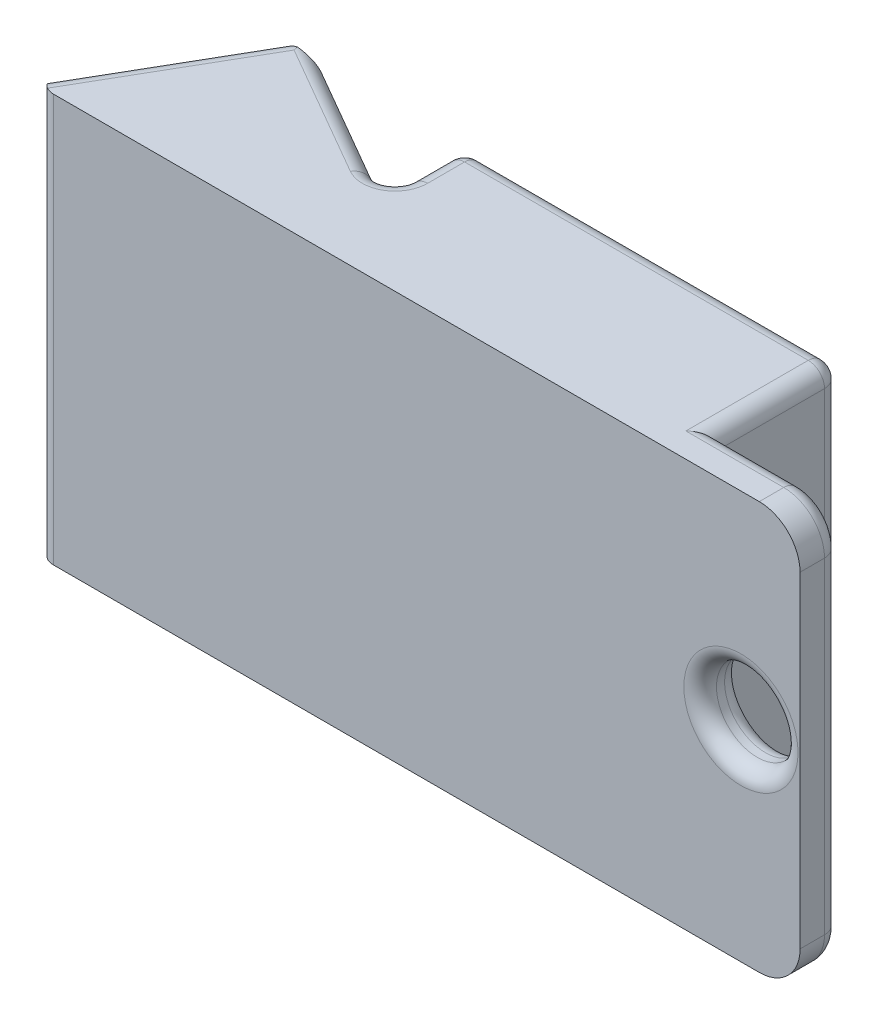
from build123d import *

# Parameters (mm, degrees)
SKETCH2_W           = 80
SKETCH2_H           = 20
BOSS_EXTRUDE1_DEPTH = 50
CUT_EXTRUDE1_DEPTH  = 50
SKETCH5_R           = 5
BOSS_EXTRUDE2_DEPTH = 5
FILLET1_R           = 2


with BuildPart() as part:
    # Sketch2 → Boss-Extrude1 (new body)
    with BuildSketch(Plane(origin=(0, 0, 0), x_dir=(1, 0, 0), z_dir=(0, 1, 0))):
        with Locations((7.295597484, 7.693920335)):
            Rectangle(SKETCH2_W, SKETCH2_H)
    extrude(amount=BOSS_EXTRUDE1_DEPTH)

    # Sketch3 → Cut-Extrude1 (cut)
    with BuildSketch(Plane(origin=(0, 50, 0), x_dir=(1, 0, 0), z_dir=(0, 1, 0))):
        Polygon((-32.704402516, 17.693920335), (-32.704402516, -2.306079665), (-21.157397132, 17.693920335), align=None)
        Polygon((1.163110944, 17.693920335), (-16.157397132, 17.693920335), (1.163110944, 7.693920335), align=None)
    extrude(amount=-CUT_EXTRUDE1_DEPTH, mode=Mode.SUBTRACT)

    # Sketch5 → Boss-Extrude2 (add)
    with BuildSketch(Plane.XY.offset(2.306079665)):
        with BuildLine():
            Line((47.295597484, 50), (57.295597484, 50))
            ThreePointArc((57.295597484, 50), (60.83113139, 48.535533906), (62.295597484, 45))
            Line((62.295597484, 45), (62.295597484, 5))
            ThreePointArc((62.295597484, 5), (60.83113139, 1.464466094), (57.295597484, 0))
            Line((57.295597484, 0), (47.295597484, 0))
            Line((47.295597484, 0), (47.295597484, 50))
        make_face()
        with Locations((55.048868237, 25.715581395)):
            Circle(SKETCH5_R, mode=Mode.SUBTRACT)
    extrude(amount=-BOSS_EXTRUDE2_DEPTH)

    # Fillet1
    # the kernel refuses this fillet: 2 mm, written as the material it adds along each edge
    with BuildSketch(Plane(origin=(1.163110944, 50, -7.693920335), x_dir=(0, 0, -1), z_dir=(0, -1, 0))) as fillet1_piece_1:
        with BuildLine():
            CenterArc((FILLET1_R * 1.73205080757, -FILLET1_R), FILLET1_R, 90, 120)
            Line((FILLET1_R * 0.866025403784, -FILLET1_R * 1.5), (0, 0))
            Line((0, 0), (FILLET1_R * 1.73205080757, 0))
        make_face()
    extrude(amount=50)
    # the kernel refuses this fillet: 2 mm, written as the material it takes off along each edge
    with BuildSketch(Plane(origin=(3.163110944, 2, -15.693920335), x_dir=(-1, 0, 0), z_dir=(0, -1, 0))) as fillet1_2_piece_1_section:
        Polygon((0, 0), (FILLET1_R, 0), (FILLET1_R, FILLET1_R), (0, FILLET1_R), align=None)
    fillet1_2_piece_1 = extrude(amount=FILLET1_R, mode=Mode.PRIVATE)
    fillet1_2_piece_1 = fillet1_2_piece_1 - Plane(origin=(3.163110944, 2, -15.693920335), x_dir=(0.7071067811865475, 0, 0.7071067811865475), z_dir=(0, -1, 0)) * Sphere(FILLET1_R, mode=Mode.PRIVATE)
    add(fillet1_2_piece_1, mode=Mode.SUBTRACT)
    with BuildSketch(Plane(origin=(3.163110944, 48, -15.693920335), x_dir=(-1, 0, 0), z_dir=(0, 1, 0))) as fillet1_2_piece_2_section:
        Polygon((0, 0), (FILLET1_R, 0), (FILLET1_R, -FILLET1_R), (0, -FILLET1_R), align=None)
    fillet1_2_piece_2 = extrude(amount=FILLET1_R, mode=Mode.PRIVATE)
    fillet1_2_piece_2 = fillet1_2_piece_2 - Plane(origin=(3.163110944, 48, -15.693920335), x_dir=(0.7071067811865475, 0, 0.7071067811865475), z_dir=(0, 1, 0)) * Sphere(FILLET1_R, mode=Mode.PRIVATE)
    add(fillet1_2_piece_2, mode=Mode.SUBTRACT)
    with BuildSketch(Plane(origin=(45.295597484, 2, -15.693920335), x_dir=(0, 0, -1), z_dir=(0, -1, 0))) as fillet1_2_piece_3_section:
        Polygon((0, 0), (FILLET1_R, 0), (FILLET1_R, FILLET1_R), (0, FILLET1_R), align=None)
    fillet1_2_piece_3 = extrude(amount=FILLET1_R, mode=Mode.PRIVATE)
    fillet1_2_piece_3 = fillet1_2_piece_3 - Plane(origin=(45.295597484, 2, -15.693920335), x_dir=(-0.7071067811865474, 0, 0.7071067811865477), z_dir=(0, -1, 0)) * Sphere(FILLET1_R, mode=Mode.PRIVATE)
    add(fillet1_2_piece_3, mode=Mode.SUBTRACT)
    with BuildSketch(Plane(origin=(45.295597484, 48, -15.693920335), x_dir=(0, 0, -1), z_dir=(0, 1, 0))) as fillet1_2_piece_4_section:
        Polygon((0, 0), (FILLET1_R, 0), (FILLET1_R, -FILLET1_R), (0, -FILLET1_R), align=None)
    fillet1_2_piece_4 = extrude(amount=FILLET1_R, mode=Mode.PRIVATE)
    fillet1_2_piece_4 = fillet1_2_piece_4 - Plane(origin=(45.295597484, 48, -15.693920335), x_dir=(-0.7071067811865474, 0, 0.7071067811865477), z_dir=(0, 1, 0)) * Sphere(FILLET1_R, mode=Mode.PRIVATE)
    add(fillet1_2_piece_4, mode=Mode.SUBTRACT)
    with BuildSketch(Plane(origin=(1.163110944, 0, -11.158021951), x_dir=(1, 0, 0), z_dir=(0, 0, -1))) as fillet1_2_piece_5:
        with BuildLine():
            CenterArc((FILLET1_R, -FILLET1_R), FILLET1_R, 90, 90)
            Line((0, -FILLET1_R), (0, 0))
            Line((0, 0), (FILLET1_R, 0))
        make_face()
    extrude(amount=4.535898385, mode=Mode.SUBTRACT)
    with BuildSketch(Plane(origin=(1.163110944, 50, -11.158021951), x_dir=(1, 0, 0), z_dir=(0, 0, -1))) as fillet1_2_piece_6:
        with BuildLine():
            CenterArc((FILLET1_R, FILLET1_R), FILLET1_R, 180, 90)
            Line((0, FILLET1_R), (0, 0))
            Line((0, 0), (FILLET1_R, 0))
        make_face()
    extrude(amount=4.535898385, mode=Mode.SUBTRACT)
    with BuildSketch(Plane(origin=(57.295597484, 0, -2.693920335), x_dir=(0, 0, 1), z_dir=(-1, 0, 0)), Plane(origin=(47.295597484, 50, -2.693920335), x_dir=(0, 0, 1), z_dir=(1, 0, 0))) as fillet1_2_piece_7:
        with BuildLine():
            CenterArc((FILLET1_R, FILLET1_R), FILLET1_R, 180, 90)
            Line((0, FILLET1_R), (0, 0))
            Line((0, 0), (FILLET1_R, 0))
        make_face()
    extrude(amount=10, mode=Mode.SUBTRACT)
    with BuildSketch(Plane(origin=(57.295597484, 5, -2.693920335), x_dir=(1, 0, 0), z_dir=(0, 1, 0))) as fillet1_2_piece_8:
        with BuildLine():
            CenterArc((5 - FILLET1_R, -FILLET1_R), FILLET1_R, 0, 90)
            Line((5, -FILLET1_R), (5, 0))
            Line((5, 0), (5 - FILLET1_R, 0))
        make_face()
    revolve(axis=Axis((57.295597484, 5, -2.693920335), (0, 0, -1)), revolution_arc=90, mode=Mode.SUBTRACT)
    with BuildSketch(Plane(origin=(62.295597484, 45, -2.693920335), x_dir=(-1, 0, 0), z_dir=(0, -1, 0))) as fillet1_2_piece_9:
        with BuildLine():
            CenterArc((FILLET1_R, -FILLET1_R), FILLET1_R, 90, 90)
            Line((0, -FILLET1_R), (0, 0))
            Line((0, 0), (FILLET1_R, 0))
        make_face()
    extrude(amount=40, mode=Mode.SUBTRACT)
    with BuildSketch(Plane(origin=(57.295597484, 45, -2.693920335), x_dir=(0, 1, 0), z_dir=(-1, 0, 0))) as fillet1_2_piece_10:
        with BuildLine():
            CenterArc((5 - FILLET1_R, -FILLET1_R), FILLET1_R, 0, 90)
            Line((5, -FILLET1_R), (5, 0))
            Line((5, 0), (5 - FILLET1_R, 0))
        make_face()
    revolve(axis=Axis((57.295597484, 45, -2.693920335), (0, 0, -1)), revolution_arc=90, mode=Mode.SUBTRACT)
    with BuildSketch(Plane(origin=(47.295597484, 2, -17.693920335), x_dir=(-1, 0, 0), z_dir=(0, 1, 0))) as fillet1_2_piece_11:
        with BuildLine():
            CenterArc((FILLET1_R, FILLET1_R), FILLET1_R, 180, 90)
            Line((0, FILLET1_R), (0, 0))
            Line((0, 0), (FILLET1_R, 0))
        make_face()
    extrude(amount=46, mode=Mode.SUBTRACT)
    with BuildSketch(Plane(origin=(3.163110944, 50, -17.693920335), x_dir=(0, 0, 1), z_dir=(1, 0, 0))) as fillet1_2_piece_12:
        with BuildLine():
            CenterArc((FILLET1_R, FILLET1_R), FILLET1_R, 180, 90)
            Line((0, FILLET1_R), (0, 0))
            Line((0, 0), (FILLET1_R, 0))
        make_face()
    extrude(amount=42.132486541, mode=Mode.SUBTRACT)
    with BuildSketch(Plane(origin=(1.163110944, 48, -17.693920335), x_dir=(0, 0, 1), z_dir=(0, -1, 0))) as fillet1_2_piece_13:
        with BuildLine():
            CenterArc((FILLET1_R, -FILLET1_R), FILLET1_R, 90, 90)
            Line((0, -FILLET1_R), (0, 0))
            Line((0, 0), (FILLET1_R, 0))
        make_face()
    extrude(amount=46, mode=Mode.SUBTRACT)
    with BuildSketch(Plane(origin=(3.163110944, 0, -17.693920335), x_dir=(0, 0, 1), z_dir=(1, 0, 0))) as fillet1_2_piece_14:
        with BuildLine():
            CenterArc((FILLET1_R, -FILLET1_R), FILLET1_R, 90, 90)
            Line((0, -FILLET1_R), (0, 0))
            Line((0, 0), (FILLET1_R, 0))
        make_face()
    extrude(amount=42.132486541, mode=Mode.SUBTRACT)
    with BuildSketch(Plane(origin=(55.048868237, 25.715581395, 2.306079665), x_dir=(1, 0, 0), z_dir=(0, -1, 0))) as fillet1_2_piece_15:
        with BuildLine():
            CenterArc((5 + FILLET1_R, -FILLET1_R), FILLET1_R, 90, 90)
            Line((5, -FILLET1_R), (5, 0))
            Line((5, 0), (5 + FILLET1_R, 0))
        make_face()
    revolve(axis=Axis((55.048868237, 25.715581395, 2.306079665), (0, 0, 1)), mode=Mode.SUBTRACT)
    with BuildSketch(Plane(origin=(55.048868237, 25.715581395, -2.693920335), x_dir=(1, 0, 0), z_dir=(0, -1, 0))) as fillet1_2_piece_16:
        with BuildLine():
            CenterArc((5 + FILLET1_R, FILLET1_R), FILLET1_R, 180, 90)
            Line((5, FILLET1_R), (5, 0))
            Line((5, 0), (5 + FILLET1_R, 0))
        make_face()
    revolve(axis=Axis((55.048868237, 25.715581395, -2.693920335), (0, 0, 1)), mode=Mode.SUBTRACT)
    with BuildSketch(Plane(origin=(47.295597484, 0, -15.693920335), x_dir=(-1, 0, 0), z_dir=(0, 0, 1))) as fillet1_2_piece_17:
        with BuildLine():
            CenterArc((FILLET1_R, -FILLET1_R), FILLET1_R, 90, 90)
            Line((0, -FILLET1_R), (0, 0))
            Line((0, 0), (FILLET1_R, 0))
        make_face()
    extrude(amount=13, mode=Mode.SUBTRACT)
    with BuildSketch(Plane(origin=(47.295597484, 50, -15.693920335), x_dir=(-1, 0, 0), z_dir=(0, 0, 1))) as fillet1_2_piece_18:
        with BuildLine():
            CenterArc((FILLET1_R, FILLET1_R), FILLET1_R, 180, 90)
            Line((0, FILLET1_R), (0, 0))
            Line((0, 0), (FILLET1_R, 0))
        make_face()
    extrude(amount=13, mode=Mode.SUBTRACT)
    with BuildSketch(Plane(origin=(-20.487524151, 0, -20.193920335), x_dir=(-0.4999999999999946, 0, 0.8660254037844418), z_dir=(0.8660254037844418, 0, 0.4999999999999946)), Plane(origin=(-20.487524151, 50, -20.193920335), x_dir=(0, -1, 0), z_dir=(0.8660254037844418, 0, 0.4999999999999946))) as fillet1_2_piece_19:
        with BuildLine():
            CenterArc((FILLET1_R, -FILLET1_R), FILLET1_R, 90, 90)
            Line((0, -FILLET1_R), (0, 0))
            Line((0, 0), (FILLET1_R, 0))
        make_face()
    extrude(amount=21.535898385, mode=Mode.SUBTRACT)
    with BuildSketch(Plane(origin=(-16.157397132, 51.339745962, -17.693920335), x_dir=(-1, 0, 0), z_dir=(0, -1, 0))) as fillet1_2_piece_20:
        with BuildLine():
            CenterArc((FILLET1_R * 0.267949192431, -FILLET1_R), FILLET1_R, 90, 30)
            Line((-FILLET1_R * 0.232050807569, -FILLET1_R * 0.133974596216), (0, 0))
            Line((0, 0), (FILLET1_R * 0.267949192431, 0))
        make_face()
    extrude(amount=52.679491924, mode=Mode.SUBTRACT)
    with BuildSketch(Plane(origin=(-32.704402516, -8.660254038, 2.306079665), x_dir=(0.49999999999999467, 0, -0.8660254037844417), z_dir=(0, 1, 0))) as fillet1_2_piece_21:
        with BuildLine():
            CenterArc((FILLET1_R * 1.73205080757, -FILLET1_R), FILLET1_R, 90, 120)
            Line((FILLET1_R * 0.866025403784, -FILLET1_R * 1.5), (0, 0))
            Line((0, 0), (FILLET1_R * 1.73205080757, 0))
        make_face()
    extrude(amount=67.320508076, mode=Mode.SUBTRACT)
    with BuildSketch(Plane(origin=(-35.204402516, 0, 6.636206683), x_dir=(0.8660254037844418, 0, 0.49999999999999445), z_dir=(0.4999999999999945, 0, -0.8660254037844419))) as fillet1_2_piece_22:
        with BuildLine():
            CenterArc((FILLET1_R, -FILLET1_R), FILLET1_R, 90, 90)
            Line((0, -FILLET1_R), (0, 0))
            Line((0, 0), (FILLET1_R, 0))
        make_face()
    extrude(amount=33.094010768, mode=Mode.SUBTRACT)
    with BuildSketch(Plane(origin=(-35.204402516, 50, 6.636206683), x_dir=(0.8660254037844418, 0, 0.49999999999999445), z_dir=(0.4999999999999945, 0, -0.8660254037844419))) as fillet1_2_piece_23:
        with BuildLine():
            CenterArc((FILLET1_R, FILLET1_R), FILLET1_R, 180, 90)
            Line((0, FILLET1_R), (0, 0))
            Line((0, 0), (FILLET1_R, 0))
        make_face()
    extrude(amount=33.094010768, mode=Mode.SUBTRACT)
    with BuildSketch(Plane(origin=(-0.836889056, 50, -11.158021951), x_dir=(1, 0, 0), z_dir=(0, 0, -1))) as fillet1_2_piece_24:
        with BuildLine():
            CenterArc((2 + FILLET1_R, FILLET1_R), FILLET1_R, 180, 90)
            Line((2, FILLET1_R), (2, 0))
            Line((2, 0), (2 + FILLET1_R, 0))
        make_face()
    revolve(axis=Axis((-0.836889056, 50, -11.158021951), (0, -1, 0)), revolution_arc=120, mode=Mode.SUBTRACT)
    with BuildSketch(Plane(origin=(-0.836889056, 0, -11.158021951), x_dir=(1, 0, 0), z_dir=(0, 0, -1))) as fillet1_2_piece_25:
        with BuildLine():
            CenterArc((2 + FILLET1_R, -FILLET1_R), FILLET1_R, 90, 90)
            Line((2, -FILLET1_R), (2, 0))
            Line((2, 0), (2 + FILLET1_R, 0))
        make_face()
    revolve(axis=Axis((-0.836889056, 0, -11.158021951), (0, -1, 0)), revolution_arc=120, mode=Mode.SUBTRACT)
    with BuildSketch(Plane(origin=(47.295597484, 0, -15.693920335), x_dir=(-1, 0, 0), z_dir=(0, 0, 1))) as fillet1_2_piece_26a_section:
        with BuildLine():
            CenterArc((FILLET1_R, -FILLET1_R), FILLET1_R, 90, 90)
            Line((0, -FILLET1_R), (0, 0))
            Line((0, 0), (FILLET1_R, 0))
        make_face()
    fillet1_2_piece_26a = extrude(amount=18, mode=Mode.PRIVATE)
    fillet1_2_piece_26a = split(fillet1_2_piece_26a, bisect_by=Plane(origin=(46.842807256, 0.452790229, -2.693920335), z_dir=(0, 0, 1)), keep=Keep.TOP, mode=Mode.PRIVATE)
    with BuildSketch(Plane(origin=(57.295597484, 0, -2.693920335), x_dir=(0, 0, 1), z_dir=(-1, 0, 0))) as fillet1_2_piece_26b_section:
        with BuildLine():
            CenterArc((FILLET1_R, FILLET1_R), FILLET1_R, 180, 90)
            Line((0, FILLET1_R), (0, 0))
            Line((0, 0), (FILLET1_R, 0))
        make_face()
    fillet1_2_piece_26b = extrude(amount=15, mode=Mode.PRIVATE)
    fillet1_2_piece_26b = split(fillet1_2_piece_26b, bisect_by=Plane(origin=(47.295597484, 0.452790229, -2.241130107), z_dir=(-1, 0, 0)), keep=Keep.TOP, mode=Mode.PRIVATE)
    fillet1_2_piece_26 = fillet1_2_piece_26a & fillet1_2_piece_26b
    add(fillet1_2_piece_26, mode=Mode.SUBTRACT)
    with BuildSketch(Plane(origin=(47.295597484, 50, -15.693920335), x_dir=(-1, 0, 0), z_dir=(0, 0, 1))) as fillet1_2_piece_27a_section:
        with BuildLine():
            CenterArc((FILLET1_R, FILLET1_R), FILLET1_R, 180, 90)
            Line((0, FILLET1_R), (0, 0))
            Line((0, 0), (FILLET1_R, 0))
        make_face()
    fillet1_2_piece_27a = extrude(amount=18, mode=Mode.PRIVATE)
    fillet1_2_piece_27a = split(fillet1_2_piece_27a, bisect_by=Plane(origin=(46.842807256, 49.547209771, -2.693920335), z_dir=(0, 0, 1)), keep=Keep.TOP, mode=Mode.PRIVATE)
    with BuildSketch(Plane(origin=(42.295597484, 50, -2.693920335), x_dir=(0, 0, 1), z_dir=(1, 0, 0))) as fillet1_2_piece_27b_section:
        with BuildLine():
            CenterArc((FILLET1_R, FILLET1_R), FILLET1_R, 180, 90)
            Line((0, FILLET1_R), (0, 0))
            Line((0, 0), (FILLET1_R, 0))
        make_face()
    fillet1_2_piece_27b = extrude(amount=15, mode=Mode.PRIVATE)
    fillet1_2_piece_27b = split(fillet1_2_piece_27b, bisect_by=Plane(origin=(47.295597484, 49.547209771, -2.241130107), z_dir=(-1, 0, 0)), keep=Keep.TOP, mode=Mode.PRIVATE)
    fillet1_2_piece_27 = fillet1_2_piece_27a & fillet1_2_piece_27b
    add(fillet1_2_piece_27, mode=Mode.SUBTRACT)


solid = part.part
